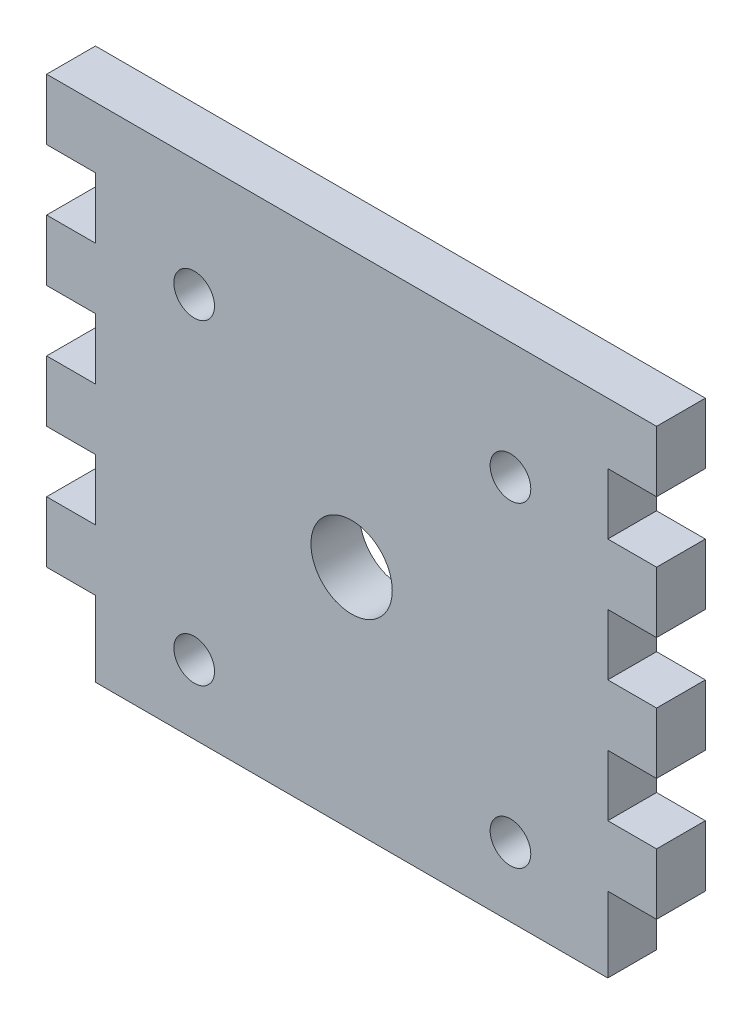
from build123d import *

# Parameters (mm, degrees)
SKETCH1_W           = 76.2
SKETCH1_H           = 76.2
BOSS_EXTRUDE1_DEPTH = 6.35
CUT_EXTRUDE1_DEPTH  = 6.35
SKETCH3_W           = 6.35
SKETCH3_H           = 38.1
CUT_EXTRUDE2_DEPTH  = 6.35
SKETCH4_W           = 6.096
SKETCH4_H           = 7.62
BOSS_EXTRUDE3_DEPTH = 6.096
SKETCH5_W           = 63.5
SKETCH5_H           = 6.35
CUT_EXTRUDE3_DEPTH  = 7.62
SKETCH6_R           = 5.08
SKETCH6_R_2         = 2.54
CUT_EXTRUDE4_DEPTH  = 71.769022866
SKETCH7_W           = 6.35
SKETCH7_H           = 7.62
BOSS_EXTRUDE4_DEPTH = 6.35
SKETCH9_W           = 63.5
SKETCH9_H           = 5.835909299
CUT_EXTRUDE5_DEPTH  = 6.35
SKETCH10_W          = 6.35
SKETCH10_H          = 6.35
BOSS_EXTRUDE5_DEPTH = 55.118
SKETCH11_W          = 6.35
SKETCH11_H          = 6.35
BOSS_EXTRUDE6_DEPTH = 55.118
CUT_EXTRUDE7_DEPTH  = 55.118
SKETCH16_W          = 6.096
SKETCH16_H          = 6.35
CUT_EXTRUDE8_DEPTH  = 2.54
SKETCH17_W          = 76.2
SKETCH17_H          = 0.254
CUT_EXTRUDE9_DEPTH  = 72.898


with BuildPart() as part:
    # Sketch1 → Boss-Extrude1 (new body)
    with BuildSketch(Plane.XY):
        with Locations((0.21991342, -21.056709957)):
            Rectangle(SKETCH1_W, SKETCH1_H)
    extrude(amount=BOSS_EXTRUDE1_DEPTH)

    # Sketch2 → Cut-Extrude1 (cut)
    with BuildSketch(Plane.XY.offset(6.35)):
        Polygon((-37.88008658, 17.043290043), (-31.53008658, 17.043290043), (-31.53008658, 9.423290043), (-37.88008658, 9.423290043), (-37.88008658, 1.803290043), (-31.53008658, 1.803290043), (-31.53008658, -5.816709957), (-37.88008658, -5.816709957), (-37.88008658, -13.436709957), (-31.53008658, -13.436709957), (-31.53008658, -21.056709957), (-37.88008658, -21.056709957), (-46.725849744, -21.056709957), (-46.725849744, 17.043290043), align=None)
        Polygon((47.165676584, -21.056709957), (47.165676584, 17.043290043), (38.31991342, 17.043290043), (31.96991342, 17.043290043), (31.96991342, 9.423290043), (38.31991342, 9.423290043), (38.31991342, 1.803290043), (31.96991342, 1.803290043), (31.96991342, -5.816709957), (38.31991342, -5.816709957), (38.31991342, -13.436709957), (31.96991342, -13.436709957), (31.96991342, -21.056709957), (38.31991342, -21.056709957), align=None)
    extrude(amount=-CUT_EXTRUDE1_DEPTH, mode=Mode.SUBTRACT)

    # Sketch3 → Cut-Extrude2 (cut)
    with BuildSketch(Plane.XY.offset(6.35)):
        with Locations((-34.70508658, -40.106709957)):
            Rectangle(SKETCH3_W, SKETCH3_H)
        with Locations((35.14491342, -40.106709957)):
            Rectangle(SKETCH3_W, SKETCH3_H)
    extrude(amount=-CUT_EXTRUDE2_DEPTH, mode=Mode.SUBTRACT)

    # Sketch4 → Boss-Extrude3 (add)
    with BuildSketch(Plane.XY.offset(6.35)):
        with Locations((-34.57808658, -24.866709957)):
            Rectangle(SKETCH4_W, SKETCH4_H)
        with Locations((35.01791342, -24.866709957)):
            Rectangle(SKETCH4_W, SKETCH4_H)
    extrude(amount=-BOSS_EXTRUDE3_DEPTH)

    # Sketch5 → Cut-Extrude3 (cut)
    with BuildSketch(Plane(origin=(0, 17.043290043, 0), x_dir=(1, 0, 0), z_dir=(0, 1, 0))):
        with Locations((0.21991342, -3.175)):
            Rectangle(SKETCH5_W, SKETCH5_H)
    extrude(amount=-CUT_EXTRUDE3_DEPTH, mode=Mode.SUBTRACT)

    # Sketch6 → Cut-Extrude4 (cut, through all)
    with BuildSketch(Plane.XY.offset(6.35)):
        with Locations((0.21991342, -24.866709957)):
            Circle(SKETCH6_R)
        with Locations((-19.446847485, -5.199949052)):
            Circle(SKETCH6_R_2)
        with Locations((20.066279447, -5.199949052)):
            Circle(SKETCH6_R_2)
        with Locations((20.066279447, -44.713075984)):
            Circle(SKETCH6_R_2)
        with Locations((-19.446847485, -44.713075984)):
            Circle(SKETCH6_R_2)
    extrude(amount=-CUT_EXTRUDE4_DEPTH, mode=Mode.SUBTRACT)

    # Sketch7 → Boss-Extrude4 (add)
    with BuildSketch(Plane.XY.offset(6.35)):
        with Locations((-34.70508658, -40.106709957)):
            Rectangle(SKETCH7_W, SKETCH7_H)
        with Locations((35.14491342, -40.106709957)):
            Rectangle(SKETCH7_W, SKETCH7_H)
    extrude(amount=-BOSS_EXTRUDE4_DEPTH)

    # Sketch9 → Cut-Extrude5 (cut)
    with BuildSketch(Plane.XY.offset(6.35)):
        with Locations((0.21991342, -56.238755307)):
            Rectangle(SKETCH9_W, SKETCH9_H)
    extrude(amount=-CUT_EXTRUDE5_DEPTH, mode=Mode.SUBTRACT)

    # Sketch10 → Boss-Extrude5 (add)
    with BuildSketch(Plane.XZ.offset(-1.803290043)):
        with Locations((35.14491342, 3.175)):
            Rectangle(SKETCH10_W, SKETCH10_H)
    extrude(amount=BOSS_EXTRUDE5_DEPTH)

    # Sketch11 → Boss-Extrude6 (add)
    with BuildSketch(Plane.XZ.offset(-1.803290043)):
        with Locations((-34.70508658, 3.175)):
            Rectangle(SKETCH11_W, SKETCH11_H)
    extrude(amount=BOSS_EXTRUDE6_DEPTH)

    # Sketch12 → Cut-Extrude7 (cut)
    with BuildSketch(Plane.XY.offset(6.35)):
        Polygon((-37.88008658, 1.803290043), (-37.88008658, 9.423290043), (-56.012271814, 9.423290043), (-56.012271814, -53.817588834), (-37.88008658, -51.536709957), (-31.78408658, -51.536709957), (-31.78408658, -43.916709957), (-37.88008658, -43.916709957), (-37.88008658, -36.296709957), (-31.78408658, -36.296709957), (-31.78408658, -28.676709957), (-37.88008658, -28.676709957), (-37.88008658, -21.056709957), (-31.78408658, -21.056709957), (-31.78408658, -13.436709957), (-37.88008658, -13.436709957), (-37.88008658, -5.816709957), (-31.78408658, -5.816709957), (-31.78408658, 1.803290043), align=None)
        Polygon((56.452098653, -53.817588834), (56.452098653, 9.423290043), (38.31991342, 9.423290043), (38.31991342, 1.803290043), (32.22391342, 1.803290043), (32.22391342, -5.816709957), (38.31991342, -5.816709957), (38.31991342, -13.436709957), (32.22391342, -13.436709957), (32.22391342, -21.056709957), (38.31991342, -21.056709957), (38.31991342, -28.676709957), (32.22391342, -28.676709957), (32.22391342, -36.296709957), (38.31991342, -36.296709957), (38.31991342, -43.916709957), (32.22391342, -43.916709957), (32.22391342, -51.536709957), (38.31991342, -51.536709957), align=None)
    extrude(amount=-CUT_EXTRUDE7_DEPTH, mode=Mode.SUBTRACT)

    # Sketch16 → Cut-Extrude8 (cut)
    with BuildSketch(Plane(origin=(0, -51.536709957, 0), x_dir=(1, 0, 0), z_dir=(0, 1, 0))):
        with Locations((-34.83208658, -3.175)):
            Rectangle(SKETCH16_W, SKETCH16_H)
        with Locations((35.27191342, -3.175)):
            Rectangle(SKETCH16_W, SKETCH16_H)
    extrude(amount=-CUT_EXTRUDE8_DEPTH, mode=Mode.SUBTRACT)

    # Sketch17 → Cut-Extrude9 (cut)
    with BuildSketch(Plane(origin=(0, 9.423290043, 0), x_dir=(1, 0, 0), z_dir=(0, 1, 0))):
        with Locations((0.21991342, -0.127)):
            Rectangle(SKETCH17_W, SKETCH17_H)
    extrude(amount=-CUT_EXTRUDE9_DEPTH, mode=Mode.SUBTRACT)


solid = part.part
